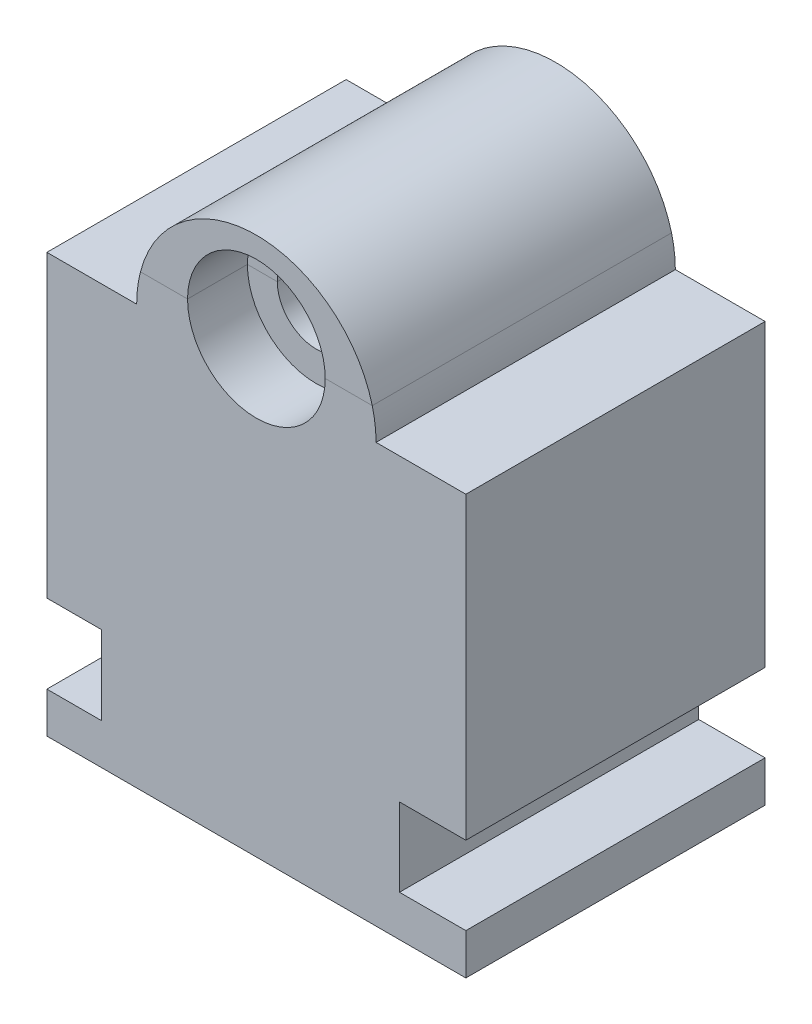
from build123d import *

# Parameters (mm, degrees)
BOSS_EXTRU_1_DEPTH      = 500
ESQUISSE2_W             = 700
ESQUISSE2_H             = 500
BOSS_EXTRU_2_DEPTH      = 250
ESQUISSE3_R             = 65
ENL_V_MAT_EXTRU_1_DEPTH = 500
ESQUISSE4_W             = 91.072749712
ESQUISSE4_H             = 131.669737078
ENL_V_MAT_EXTRU_2_DEPTH = 500
ESQUISSE5_W             = 110.887682399
ESQUISSE5_H             = 130.745719327
ENL_V_MAT_EXTRU_3_DEPTH = 500
ENL_V_START             = -100
ESQUISSE6_R             = 115
ESQUISSE6_R_2           = 65
ENL_V_MAT_EXTRU_4_DEPTH = 100
ESQUISSE7_R             = 115
ESQUISSE7_R_2           = 65
ENL_V_MAT_EXTRU_5_DEPTH = 100


with BuildPart() as part:
    # Esquisse1 → Boss.-Extru.1 (new body)
    with BuildSketch(Plane.XY):
        with BuildLine():
            Line((0, 0), (700, 0))
            Line((700, 0), (700, 450))
            Line((700, 450), (550, 450))
            ThreePointArc((550, 450), (350, 650), (150, 450))
            Line((150, 450), (0, 450))
            Line((0, 450), (0, 0))
        make_face()
    extrude(amount=BOSS_EXTRU_1_DEPTH)

    # Esquisse2 → Boss.-Extru.2 (add)
    with BuildSketch(Plane.XZ):
        with Locations((350, 250)):
            Rectangle(ESQUISSE2_W, ESQUISSE2_H)
    extrude(amount=BOSS_EXTRU_2_DEPTH)

    # Esquisse3 → Enlèv. mat.-Extru.1 (cut)
    with BuildSketch(Plane(origin=(0, 0, 0), x_dir=(-1, 0, 0), z_dir=(0, 0, -1))):
        with Locations((-350, 500)):
            Circle(ESQUISSE3_R)
    extrude(amount=-ENL_V_MAT_EXTRU_1_DEPTH, mode=Mode.SUBTRACT)

    # Esquisse4 → Enlèv. mat.-Extru.2 (cut)
    with BuildSketch(Plane(origin=(0, 0, 0), x_dir=(-1, 0, 0), z_dir=(0, 0, -1))):
        with Locations((-45.536374856, -116.153722116)):
            Rectangle(ESQUISSE4_W, ESQUISSE4_H)
    extrude(amount=-ENL_V_MAT_EXTRU_2_DEPTH, mode=Mode.SUBTRACT)

    # Esquisse5 → Enlèv. mat.-Extru.3 (cut)
    with BuildSketch(Plane(origin=(0, 0, 0), x_dir=(-1, 0, 0), z_dir=(0, 0, -1))):
        with Locations((-644.556158801, -116.03155185)):
            Rectangle(ESQUISSE5_W, ESQUISSE5_H)
    extrude(amount=-ENL_V_MAT_EXTRU_3_DEPTH, mode=Mode.SUBTRACT)

    # Esquisse6 → Enlèv. mat.-Extru.4 (cut)
    with BuildSketch(Plane.XY.offset(500).offset(ENL_V_START)):
        with Locations((350, 500)):
            Circle(ESQUISSE6_R)
        with Locations((350, 500)):
            Circle(ESQUISSE6_R_2, mode=Mode.SUBTRACT)
    extrude(amount=ENL_V_MAT_EXTRU_4_DEPTH, mode=Mode.SUBTRACT)


with BuildPart() as body_2:
    # Fractionner2: the piece on the far side of the plane
    add(part.part)
    split(bisect_by=Plane(origin=(0, 500, 0), x_dir=(0, 0, -1), z_dir=(0, -1, 0)), keep=Keep.BOTTOM)


with BuildPart() as part_1:
    add(part.part)

    # Fractionner2
    split(bisect_by=Plane(origin=(0, 500, 0), x_dir=(0, 0, -1), z_dir=(0, -1, 0)), keep=Keep.TOP)


with BuildPart() as enl_v_mat_extru_5_tool:
    # Esquisse7 → Enlèv. mat.-Extru.5 (new body)
    with BuildSketch(Plane(origin=(0, 0, 0), x_dir=(-1, 0, 0), z_dir=(0, 0, -1))):
        with Locations((-350, 500)):
            Circle(ESQUISSE7_R)
        with Locations((-350, 500)):
            Circle(ESQUISSE7_R_2, mode=Mode.SUBTRACT)
    extrude(amount=-ENL_V_MAT_EXTRU_5_DEPTH)


with BuildPart() as part_2:
    add(part_1.part)

    # Enlèv. mat.-Extru.5: cut by enl_v_mat_extru_5_tool
    add(enl_v_mat_extru_5_tool.part, mode=Mode.SUBTRACT)


with BuildPart() as body_2_1:
    add(body_2.part)

    # Enlèv. mat.-Extru.5: cut by enl_v_mat_extru_5_tool
    add(enl_v_mat_extru_5_tool.part, mode=Mode.SUBTRACT)


solid = Compound([part_2.part, body_2_1.part])
